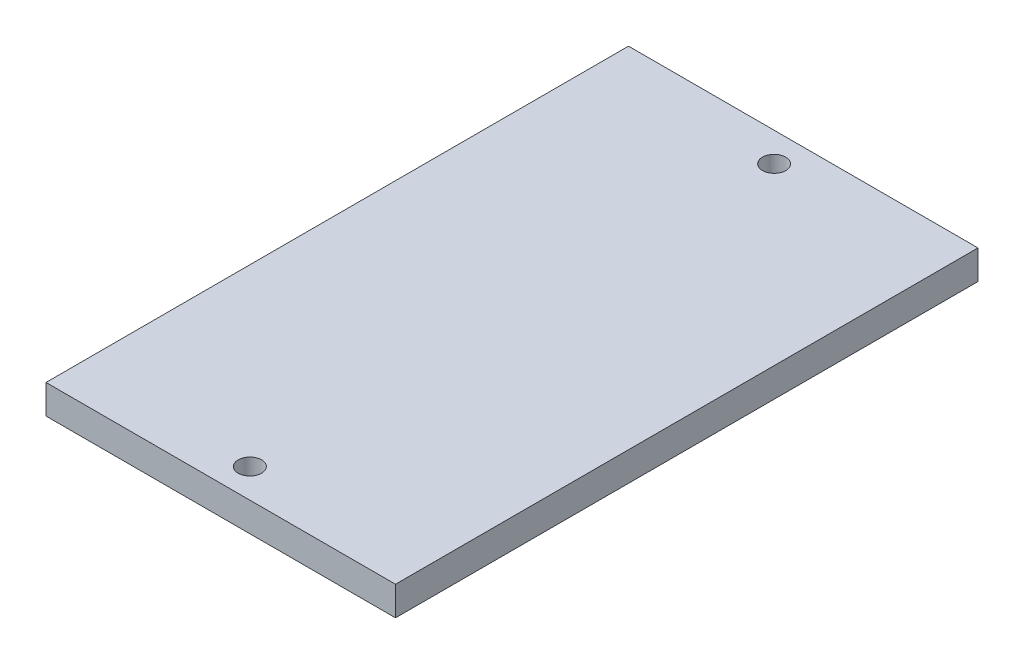
from build123d import *

# Parameters (mm, degrees)
SKETCH2_W           = 76.2
SKETCH2_H           = 127
BOSS_EXTRUDE1_DEPTH = 6.35
SKETCH6_R           = 2.54
CUT_EXTRUDE3_DEPTH  = 9.525


with BuildPart() as part:
    # Sketch2 → Boss-Extrude1 (new body)
    with BuildSketch(Plane(origin=(0, 0, 0), x_dir=(1, 0, 0), z_dir=(0, 1, 0))):
        with Locations((-1.871480339, 0)):
            Rectangle(SKETCH2_W, SKETCH2_H)
    extrude(amount=BOSS_EXTRUDE1_DEPTH)

    # Sketch6 → Cut-Extrude3 (cut)
    with BuildSketch(Plane(origin=(0, 6.35, 0), x_dir=(1, 0, 0), z_dir=(0, 1, 0))):
        with Locations((-1.871480339, 57.15)):
            Circle(SKETCH6_R)
        with Locations((-1.871480339, -57.15)):
            Circle(SKETCH6_R)
    extrude(amount=-CUT_EXTRUDE3_DEPTH, mode=Mode.SUBTRACT)


solid = part.part
